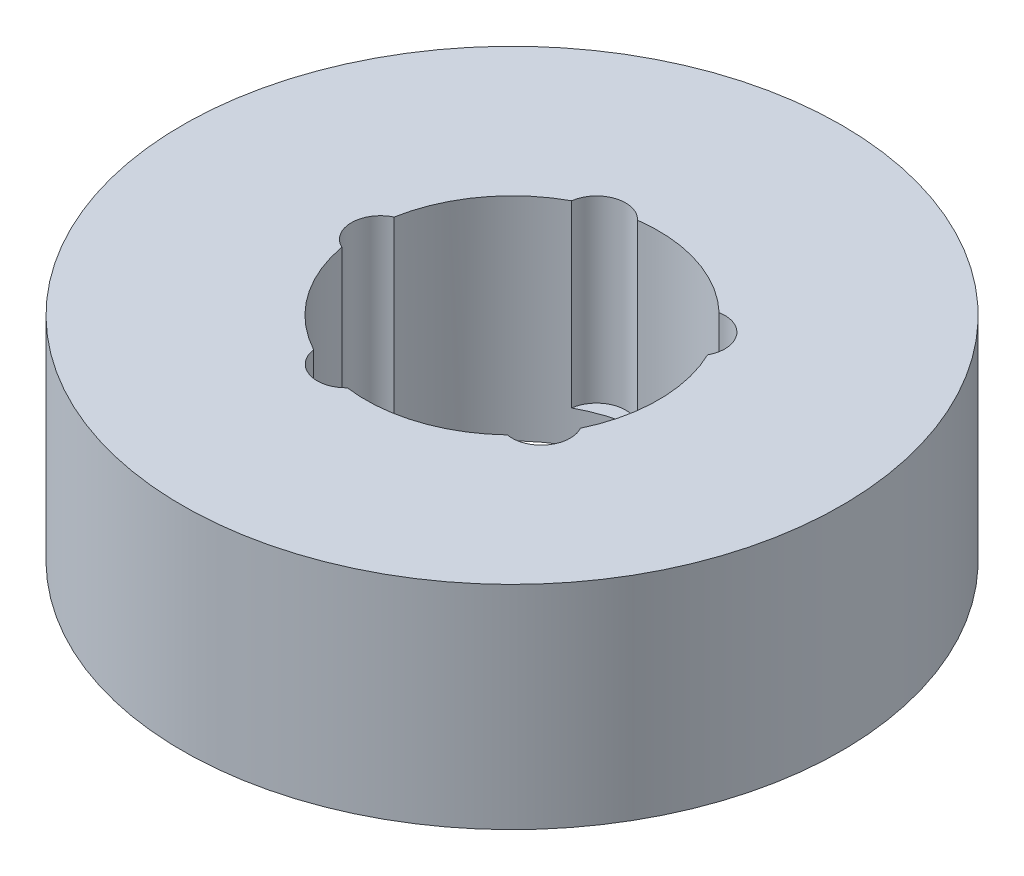
from build123d import *

# Parameters (mm, degrees)
SKETCH1_R           = 45
BOSS_EXTRUDE1_DEPTH = 29
SKETCH2_R           = 20
CUT_EXTRUDE1_DEPTH  = 70.93568474
SKETCH3_R           = 3.960818502
CUT_EXTRUDE2_DEPTH  = 24.500264386
CIRPATTERN1_COUNT   = 5


with BuildPart() as part:
    # Sketch1 → Boss-Extrude1 (new body)
    with BuildSketch(Plane(origin=(0, 0, 0), x_dir=(1, 0, 0), z_dir=(0, 1, 0))):
        Circle(SKETCH1_R)
    extrude(amount=BOSS_EXTRUDE1_DEPTH)

    # Sketch2 → Cut-Extrude1 (cut, through all)
    with BuildSketch(Plane(origin=(0, 0, 0), x_dir=(1, 0, 0), z_dir=(0, 1, 0))):
        Circle(SKETCH2_R)
    extrude(amount=CUT_EXTRUDE1_DEPTH, mode=Mode.SUBTRACT)

    # Sketch3 → Cut-Extrude2 (cut)
    with BuildSketch(Plane(origin=(0, 29, 0), x_dir=(1, 0, 0), z_dir=(0, 1, 0))):
        with Locations((-17.971215297, 0)):
            Circle(SKETCH3_R)
    cut_extrude2 = extrude(amount=-CUT_EXTRUDE2_DEPTH, mode=Mode.SUBTRACT)

    # CirPattern1: Cut-Extrude2 ×5 about axis
    cirpattern1_axis = Axis((0, 0, 0), (0, 1, 0))
    for i in range(1, CIRPATTERN1_COUNT):
        add(cut_extrude2.rotate(cirpattern1_axis, i * 360 / CIRPATTERN1_COUNT), mode=Mode.SUBTRACT)


solid = part.part
